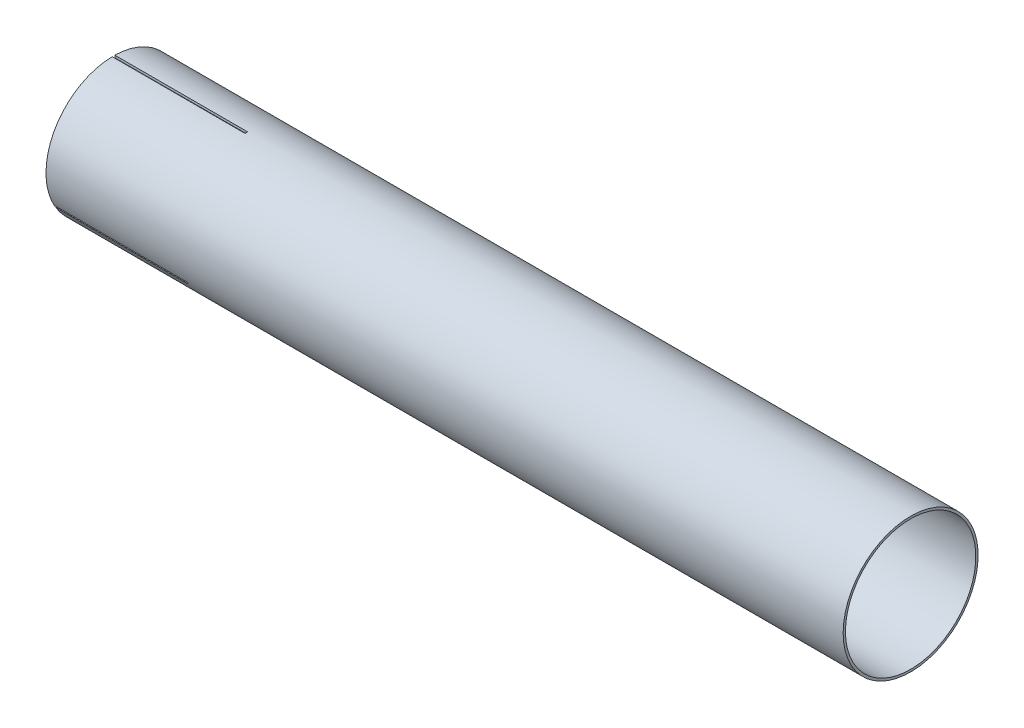
from build123d import *

# Parameters (mm, degrees)
ESQUISSE1_W                  = 900
ESQUISSE1_H                  = 2.5908
ESQUISSE2_W                  = 150
ESQUISSE2_H                  = 3
ENL_V_MAT_EXTRU_1_DEPTH      = 907.428640324
R_P_TITION_CIRCULAIRE1_COUNT = 3
R_P_TITION_CIRCULAIRE1_ANGLE = 240


with BuildPart() as part:
    # Esquisse1 → Révolution1 (revolve)
    with BuildSketch(Plane.XY):
        with Locations((450, 74.9046)):
            Rectangle(ESQUISSE1_W, ESQUISSE1_H)
    revolve(axis=Axis((0, 0, 0), (1, 0, 0)))

    # Esquisse2 → Enlèv. mat.-Extru.1 (cut, through all)
    with BuildSketch(Plane(origin=(0, 0, 0), x_dir=(1, 0, 0), z_dir=(0, 1, 0))):
        with Locations((75, 0)):
            Rectangle(ESQUISSE2_W, ESQUISSE2_H)
    enl_v_mat_extru_1 = extrude(amount=ENL_V_MAT_EXTRU_1_DEPTH, mode=Mode.SUBTRACT)

    # Répétition circulaire1: Enlèv. mat.-Extru.1 ×3 about axis
    r_p_tition_circulaire1_axis = Axis((900, 0, 0), (-1, 0, 0))
    for i in range(1, R_P_TITION_CIRCULAIRE1_COUNT):
        add(enl_v_mat_extru_1.rotate(r_p_tition_circulaire1_axis, i * R_P_TITION_CIRCULAIRE1_ANGLE / (R_P_TITION_CIRCULAIRE1_COUNT - 1)), mode=Mode.SUBTRACT)


solid = part.part
